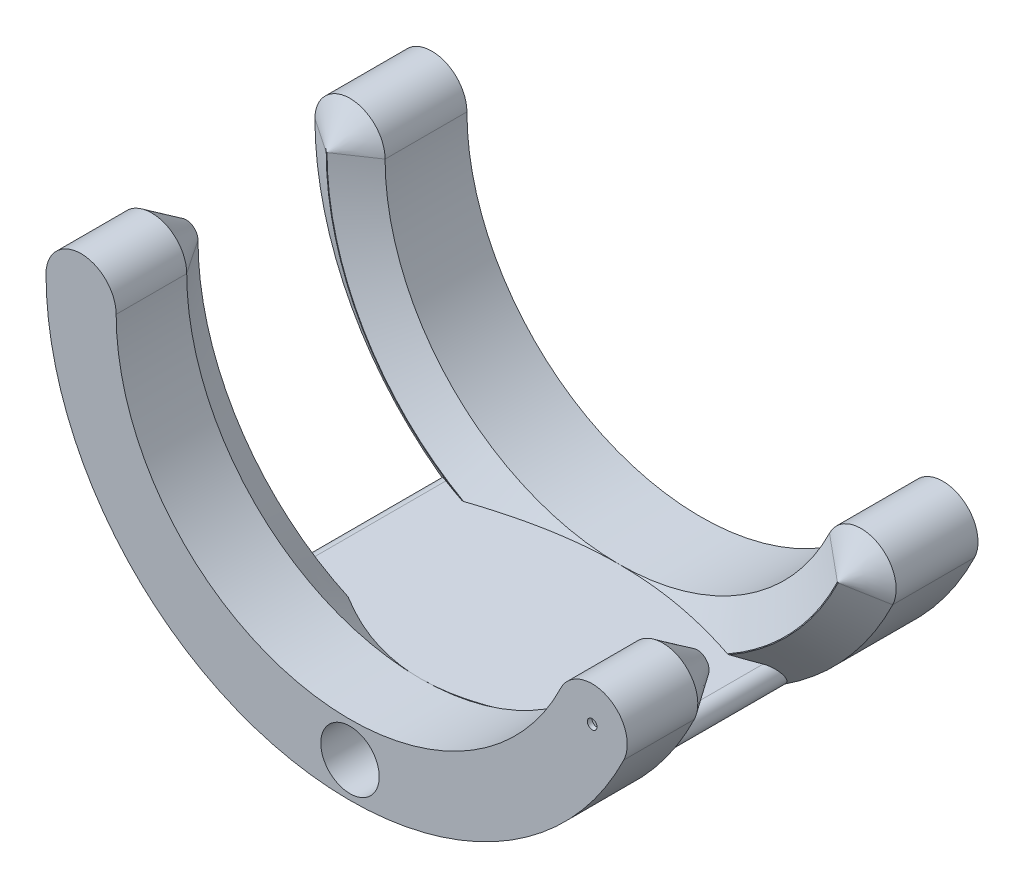
from build123d import *

# Parameters (mm, degrees)
SKETCH1_R               = 3.175
BOSS_EXTRUDE1_DEPTH     = 38.1
SKETCH2_R               = 0.524148551
CUT_EXTRUDE1_DEPTH      = 0.508
CUT_EXTRUDE2_DEPTH      = 74.375236584
CUT_EXTRUDE2_DEPTH_BACK = 74.375236584
SKETCH4_W               = 15.24
SKETCH4_H               = 29.21
CHAMFER1_SIZE           = 3.76570486
CHAMFER1_SIZE_2         = 2.54
FILLET1_R               = 1.27


with BuildPart() as part:
    # Sketch1 → Boss-Extrude1 (new body)
    with BuildSketch(Plane.XY):
        with BuildLine():
            ThreePointArc((3.431040036, -1.656521739), (1.656521739, 3.431040036), (-3.431040036, 1.656521739))
            ThreePointArc((-3.431040036, 1.656521739), (-31.969026999, -12.060345778), (-51.704640275, 12.7))
            ThreePointArc((-51.704640275, 12.7), (-55.514640275, 16.51), (-59.324640275, 12.7))
            ThreePointArc((-59.324640275, 12.7), (-33.668343017, -19.488449511), (3.431040036, -1.656521739))
        make_face()
        with Locations(Location((-26.304640275, -16.51, 0), (0, 0, 180))):
            Circle(SKETCH1_R, mode=Mode.SUBTRACT)
    extrude(amount=BOSS_EXTRUDE1_DEPTH)

    # Sketch2 → Cut-Extrude1 (cut)
    with BuildSketch(Plane.XY.offset(38.1)):
        Circle(SKETCH2_R)
    cut_extrude1 = extrude(amount=-CUT_EXTRUDE1_DEPTH, mode=Mode.SUBTRACT)

    # Mirror1: Cut-Extrude1 across plane
    add(cut_extrude1.mirror(Plane.XY.offset(19.05)), mode=Mode.SUBTRACT)

    # Sketch4 → Cut-Extrude2 (cut, two sides: drawn at the far end of the back side and taken through both)
    with BuildSketch(Plane(origin=(0, 0, 0), x_dir=(0, 0, -1), z_dir=(1, 0, 0)).offset(-CUT_EXTRUDE2_DEPTH_BACK)):
        with Locations((-19.05, 1.905)):
            Rectangle(SKETCH4_W, SKETCH4_H)
    extrude(amount=CUT_EXTRUDE2_DEPTH + CUT_EXTRUDE2_DEPTH_BACK, mode=Mode.SUBTRACT)

    # Chamfer1
    # the kernel refuses this chamfer: 3.76570486, 2.54 mm, written as the material it takes off along each edge
    with BuildSketch(Plane(origin=(-26.304640275, 12.7, 26.67), x_dir=(0.9005354424873034, -0.43478260869565205, 0), z_dir=(0.43478260869565205, 0.9005354424873034, 0))) as chamfer1_piece_1_section:
        Polygon((25.4, -CHAMFER1_SIZE), (25.4 + CHAMFER1_SIZE_2, 0), (25.4, 0), align=None)
    chamfer1_piece_1 = revolve(axis=Axis((-26.304640275, 12.7, 26.67), (0, 0, -1)), revolution_arc=64.228538259, mode=Mode.PRIVATE)
    chamfer1_piece_1 = split(chamfer1_piece_1, bisect_by=Plane(origin=(-26.304640275, -12.7, 26.67), z_dir=(0, 1, 0)), keep=Keep.TOP, mode=Mode.PRIVATE)
    add(chamfer1_piece_1, mode=Mode.SUBTRACT)
    with BuildSketch(Plane(origin=(-26.304640275, 12.7, 26.67), x_dir=(0.9005354424873037, -0.43478260869565155, 0), z_dir=(0.43478260869565155, 0.9005354424873037, 0))) as chamfer1_piece_2_section:
        Polygon((33.02, -CHAMFER1_SIZE), (33.02 - CHAMFER1_SIZE_2, 0), (33.02, 0), align=None)
    chamfer1_piece_2 = revolve(axis=Axis((-26.304640275, 12.7, 26.67), (0, 0, -1)), revolution_arc=41.395045941, mode=Mode.PRIVATE)
    chamfer1_piece_2 = split(chamfer1_piece_2, bisect_by=Plane(origin=(-26.304640275, -12.7, 26.67), z_dir=(0, 1, 0)), keep=Keep.TOP, mode=Mode.PRIVATE)
    add(chamfer1_piece_2, mode=Mode.SUBTRACT)
    with BuildSketch(Plane(origin=(0, 0, 26.67), x_dir=(-0.9005354424873006, 0.4347826086956581, 0), z_dir=(-0.4347826086956581, -0.9005354424873006, 0))) as chamfer1_piece_3:
        Polygon((3.81, -CHAMFER1_SIZE), (3.81 - CHAMFER1_SIZE_2, 0), (3.81, 0), align=None)
    revolve(axis=Axis((0, 0, 26.67), (0, 0, -1)), revolution_arc=180, mode=Mode.SUBTRACT)
    with BuildSketch(Plane(origin=(-26.304640275, 12.7, 26.67), x_dir=(0, -1, 0), z_dir=(1, 0, 0))) as chamfer1_piece_4_section:
        Polygon((25.4 + CHAMFER1_SIZE_2, 0), (25.4, -CHAMFER1_SIZE), (25.4, 0), align=None)
    chamfer1_piece_4 = revolve(axis=Axis((-26.304640275, 12.7, 26.67), (0, 0, -1)), revolution_arc=90, mode=Mode.PRIVATE)
    chamfer1_piece_4 = split(chamfer1_piece_4, bisect_by=Plane(origin=(-26.304640275, -12.7, 26.67), z_dir=(0, 1, 0)), keep=Keep.TOP, mode=Mode.PRIVATE)
    add(chamfer1_piece_4, mode=Mode.SUBTRACT)
    with BuildSketch(Plane(origin=(-55.514640275, 12.7, 26.67), x_dir=(1, 0, 0), z_dir=(0, -1, 0))) as chamfer1_piece_5:
        Polygon((3.81 - CHAMFER1_SIZE_2, 0), (3.81, CHAMFER1_SIZE), (3.81, 0), align=None)
    revolve(axis=Axis((-55.514640275, 12.7, 26.67), (0, 0, 1)), revolution_arc=180, mode=Mode.SUBTRACT)
    with BuildSketch(Plane(origin=(-26.304640275, 12.7, 26.67), x_dir=(-0.38802844135428005, -0.9216473993345654, 0), z_dir=(0.9216473993345654, -0.38802844135428005, 0))) as chamfer1_piece_6_section:
        Polygon((33.02, -CHAMFER1_SIZE), (33.02 - CHAMFER1_SIZE_2, 0), (33.02, 0), align=None)
    chamfer1_piece_6 = revolve(axis=Axis((-26.304640275, 12.7, 26.67), (0, 0, -1)), revolution_arc=67.168121234, mode=Mode.PRIVATE)
    chamfer1_piece_6 = split(chamfer1_piece_6, bisect_by=Plane(origin=(-26.304640275, -12.7, 26.67), z_dir=(0, 1, 0)), keep=Keep.TOP, mode=Mode.PRIVATE)
    add(chamfer1_piece_6, mode=Mode.SUBTRACT)
    with BuildSketch(Plane(origin=(-26.304640275, 12.7, 11.43), x_dir=(0.9005354424873034, -0.43478260869565205, 0), z_dir=(0.43478260869565205, 0.9005354424873034, 0))) as chamfer1_piece_7_section:
        Polygon((25.4, CHAMFER1_SIZE_2), (25.4 + CHAMFER1_SIZE, 0), (25.4, 0), align=None)
    chamfer1_piece_7 = revolve(axis=Axis((-26.304640275, 12.7, 11.43), (0, 0, -1)), revolution_arc=64.228538259, mode=Mode.PRIVATE)
    chamfer1_piece_7 = split(chamfer1_piece_7, bisect_by=Plane(origin=(-26.304640275, -12.7, 11.43), z_dir=(0, 1, 0)), keep=Keep.TOP, mode=Mode.PRIVATE)
    add(chamfer1_piece_7, mode=Mode.SUBTRACT)
    with BuildSketch(Plane(origin=(-26.304640275, 12.7, 11.43), x_dir=(0, -1, 0), z_dir=(1, 0, 0))) as chamfer1_piece_8_section:
        Polygon((25.4, CHAMFER1_SIZE_2), (25.4 + CHAMFER1_SIZE, 0), (25.4, 0), align=None)
    chamfer1_piece_8 = revolve(axis=Axis((-26.304640275, 12.7, 11.43), (0, 0, -1)), revolution_arc=90, mode=Mode.PRIVATE)
    chamfer1_piece_8 = split(chamfer1_piece_8, bisect_by=Plane(origin=(-26.304640275, -12.7, 11.43), z_dir=(0, 1, 0)), keep=Keep.TOP, mode=Mode.PRIVATE)
    add(chamfer1_piece_8, mode=Mode.SUBTRACT)
    with BuildSketch(Plane(origin=(-26.304640275, 12.7, 11.43), x_dir=(-0.38802844135427855, -0.9216473993345662, 0), z_dir=(0.9216473993345662, -0.38802844135427855, 0))) as chamfer1_piece_9_section:
        Polygon((33.02, CHAMFER1_SIZE_2), (33.02 - CHAMFER1_SIZE, 0), (33.02, 0), align=None)
    chamfer1_piece_9 = revolve(axis=Axis((-26.304640275, 12.7, 11.43), (0, 0, -1)), revolution_arc=67.168121234, mode=Mode.PRIVATE)
    chamfer1_piece_9 = split(chamfer1_piece_9, bisect_by=Plane(origin=(-26.304640275, -12.7, 11.43), z_dir=(0, 1, 0)), keep=Keep.TOP, mode=Mode.PRIVATE)
    add(chamfer1_piece_9, mode=Mode.SUBTRACT)
    with BuildSketch(Plane(origin=(-26.304640275, 12.7, 11.43), x_dir=(0.9005354424873037, -0.43478260869565155, 0), z_dir=(0.43478260869565155, 0.9005354424873037, 0))) as chamfer1_piece_10_section:
        Polygon((33.02, CHAMFER1_SIZE_2), (33.02 - CHAMFER1_SIZE, 0), (33.02, 0), align=None)
    chamfer1_piece_10 = revolve(axis=Axis((-26.304640275, 12.7, 11.43), (0, 0, -1)), revolution_arc=41.395045941, mode=Mode.PRIVATE)
    chamfer1_piece_10 = split(chamfer1_piece_10, bisect_by=Plane(origin=(-26.304640275, -12.7, 11.43), z_dir=(0, 1, 0)), keep=Keep.TOP, mode=Mode.PRIVATE)
    add(chamfer1_piece_10, mode=Mode.SUBTRACT)
    with BuildSketch(Plane(origin=(-55.514640275, 12.7, 11.43), x_dir=(1, 0, 0), z_dir=(0, -1, 0))) as chamfer1_piece_11:
        Polygon((3.81, -CHAMFER1_SIZE_2), (3.81 - CHAMFER1_SIZE, 0), (3.81, 0), align=None)
    revolve(axis=Axis((-55.514640275, 12.7, 11.43), (0, 0, 1)), revolution_arc=180, mode=Mode.SUBTRACT)
    with BuildSketch(Plane(origin=(0, 0, 11.43), x_dir=(-0.9005354424873006, 0.4347826086956581, 0), z_dir=(-0.4347826086956581, -0.9005354424873006, 0))) as chamfer1_piece_12:
        Polygon((3.81 - CHAMFER1_SIZE, 0), (3.81, CHAMFER1_SIZE_2), (3.81, 0), align=None)
    revolve(axis=Axis((0, 0, 11.43), (0, 0, -1)), revolution_arc=180, mode=Mode.SUBTRACT)

    # Fillet1
    fillet1_edges = [part.edges().sort_by_distance(p)[0] for p in [
        (-5.205815663, -12.7, 19.66285243),
        (-47.403464887, -12.7, 19.66285243),
    ]]
    fillet(fillet1_edges, radius=FILLET1_R)


solid = part.part
